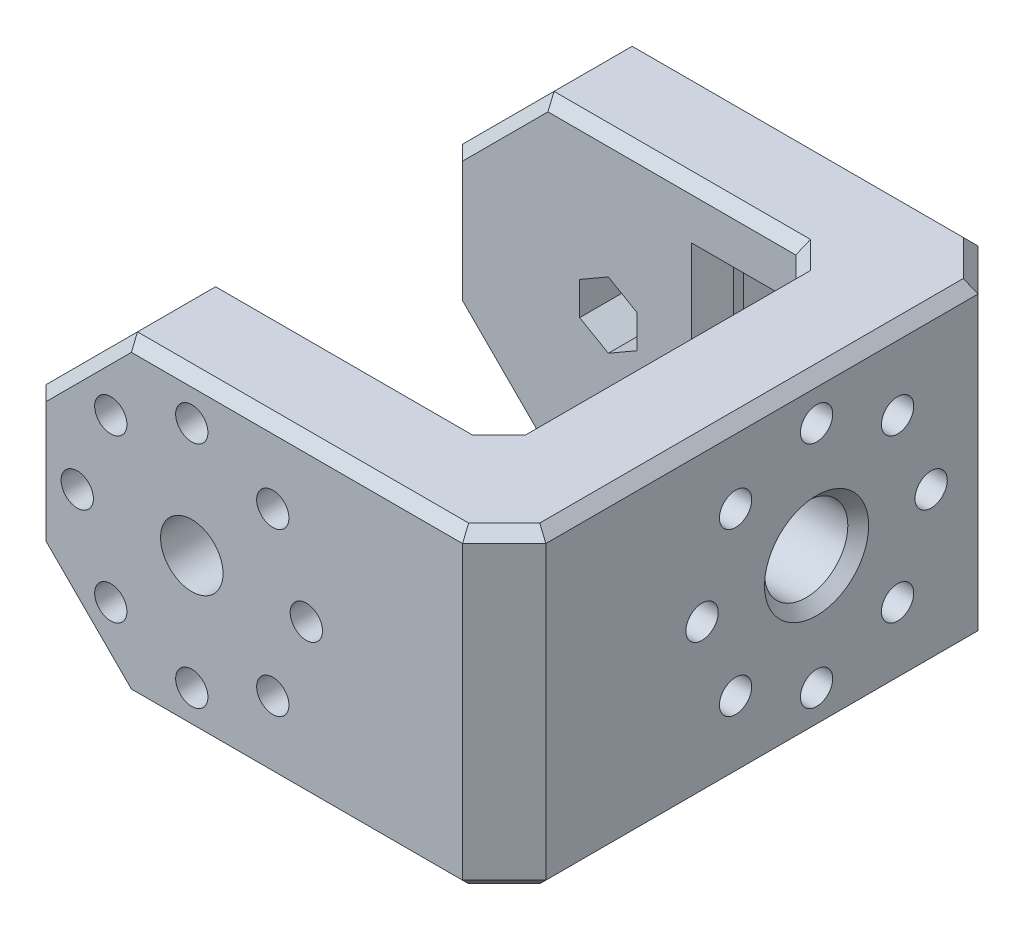
from build123d import *

# Parameters (mm, degrees)
SALIENTE_EXTRUIR1_DEPTH = 60
CROQUIS2_W              = 35
CROQUIS2_H              = 30.5
CROQUIS2_H_2            = 10.5
CORTAR_EXTRUIR1_DEPTH   = 74.484692283
CORTAR_EXTRUIR2_REACH   = 70.739
CROQUIS3_R              = 3
CROQUIS12_R             = 6
SALIENTE_EXTRUIR2_DEPTH = 1
CORTAR_EXTRUIR3_REACH   = 62.624
CROQUIS4_R              = 1.5
CORTAR_EXTRUIR4_DEPTH   = 5
CROQUIS9_W              = 10
CROQUIS9_H              = 20
CORTAR_EXTRUIR7_DEPTH   = 5
CORTAR_EXTRUIR5_REACH   = 78.485
CROQUIS7_R              = 4
CROQUIS7_R_2            = 1.55
CORTAR_EXTRUIR6_REACH   = 83.485
CORTAR_EXTRUIR6_START   = -5
CORTAR_EXTRUIR8_REACH   = 70.739
CROQUIS10_R             = 1.55
CORTAR_EXTRUIR9_REACH   = 75.739
CORTAR_EXTRUIR9_START   = -5
CROQUIS13_W             = 10
CROQUIS13_H             = 10.5
CORTAR_EXTRUIR10_DEPTH  = 74.484692283
CHAFL_N7_SIZE           = 4
CHAFL_N5_SIZE           = 0.5
CHAFL_N6_SIZE           = 1
CHAFL_N4_SIZE           = 1
CHAFL_N3_SIZE           = 1
CHAFL_N1_SIZE           = 2
CHAFL_N2_SIZE           = 1


# Some blends are built 0.0001 mm under size
with BuildPart() as part:
    # Croquis1 → Saliente-Extruir1 (new body)
    with BuildSketch(Plane.XY):
        Polygon((6.213203436, 15), (30, 15), (30, -15), (6.213203436, -15), (-6.213203436, -15), (-15, -6.213203436), (-15, 6.213203436), (-6.213203436, 15), align=None)
    extrude(amount=SALIENTE_EXTRUIR1_DEPTH)

    # Croquis2 → Cortar-Extruir1 (cut, through all)
    with BuildSketch(Plane(origin=(0, 15, 0), x_dir=(1, 0, 0), z_dir=(0, 1, 0))):
        with Locations((2.5, -35.25)):
            Rectangle(CROQUIS2_W, CROQUIS2_H)
        with Locations((2.5, -5.25)):
            Rectangle(CROQUIS2_W, CROQUIS2_H_2)
    extrude(amount=-CORTAR_EXTRUIR1_DEPTH, mode=Mode.SUBTRACT)

    # Croquis3 → Cortar-Extruir2 (cut, up to next)
    with BuildSketch(Plane.XY.offset(60), mode=Mode.PRIVATE) as cortar_extruir2_sk1:
        Circle(CROQUIS3_R)
    cortar_extruir2_tool1 = extrude(cortar_extruir2_sk1.sketch, amount=-CORTAR_EXTRUIR2_REACH, mode=Mode.PRIVATE) & part.part
    add(cortar_extruir2_tool1.solids().sort_by_distance((0, 0, 60))[0], mode=Mode.SUBTRACT)

    # Croquis12 → Saliente-Extruir2 (add)
    with BuildSketch(Plane(origin=(0, 0, 10.5), x_dir=(-1, 0, 0), z_dir=(0, 0, -1))):
        with Locations(Location((0, 0, 0), (0, 0, 180))):
            Circle(CROQUIS12_R)
    extrude(amount=SALIENTE_EXTRUIR2_DEPTH)

    # Croquis4 → Cortar-Extruir3 (cut, up to next)
    with BuildSketch(Plane(origin=(0, 0, 9.5), x_dir=(-1, 0, 0), z_dir=(0, 0, -1)), mode=Mode.PRIVATE) as cortar_extruir3_sk1:
        Circle(CROQUIS4_R)
    cortar_extruir3_tool1 = extrude(cortar_extruir3_sk1.sketch, amount=-CORTAR_EXTRUIR3_REACH, mode=Mode.PRIVATE) & part.part
    add(cortar_extruir3_tool1.solids().sort_by_distance((0, 0, 9.5))[0], mode=Mode.SUBTRACT)

    # Croquis5 → Cortar-Extruir4 (cut)
    with BuildSketch(Plane.XY.offset(20)):
        Polygon((0, 3.175426481), (-2.75, 1.58771324), (-2.75, -1.58771324), (0, -3.175426481), (2.75, -1.58771324), (2.75, 1.58771324), align=None)
    extrude(amount=-CORTAR_EXTRUIR4_DEPTH, mode=Mode.SUBTRACT)

    # Croquis9 → Cortar-Extruir7 (cut)
    with BuildSketch(Plane.XY.offset(20)):
        with Locations((15, 0)):
            Rectangle(CROQUIS9_W, CROQUIS9_H)
    extrude(amount=-CORTAR_EXTRUIR7_DEPTH, mode=Mode.SUBTRACT)

    # Croquis7 → Cortar-Extruir5 (cut, up to next)
    with BuildSketch(Plane(origin=(30, 0, 0), x_dir=(0, 0, -1), z_dir=(1, 0, 0)), mode=Mode.PRIVATE) as cortar_extruir5_sk1:
        with Locations(Location((-30, 0, 0), (0, 0, 90))):
            Circle(CROQUIS7_R)
    cortar_extruir5_tool1 = extrude(cortar_extruir5_sk1.sketch, amount=-CORTAR_EXTRUIR5_REACH, mode=Mode.PRIVATE) & part.part
    # Croquis7 → Cortar-Extruir5 (cut, up to next)
    with BuildSketch(Plane(origin=(30, 0, 0), x_dir=(0, 0, -1), z_dir=(1, 0, 0)), mode=Mode.PRIVATE) as cortar_extruir5_sk2:
        with Locations(Location((-30, 11, 0), (0, 0, 90))):
            Circle(CROQUIS7_R_2)
    cortar_extruir5_tool2 = extrude(cortar_extruir5_sk2.sketch, amount=-CORTAR_EXTRUIR5_REACH, mode=Mode.PRIVATE) & part.part
    # Croquis7 → Cortar-Extruir5 (cut, up to next)
    with BuildSketch(Plane(origin=(30, 0, 0), x_dir=(0, 0, -1), z_dir=(1, 0, 0)), mode=Mode.PRIVATE) as cortar_extruir5_sk3:
        with Locations(Location((-22.221825407, 7.778174593, 0), (0, 0, 90))):
            Circle(CROQUIS7_R_2)
    cortar_extruir5_tool3 = extrude(cortar_extruir5_sk3.sketch, amount=-CORTAR_EXTRUIR5_REACH, mode=Mode.PRIVATE) & part.part
    # Croquis7 → Cortar-Extruir5 (cut, up to next)
    with BuildSketch(Plane(origin=(30, 0, 0), x_dir=(0, 0, -1), z_dir=(1, 0, 0)), mode=Mode.PRIVATE) as cortar_extruir5_sk4:
        with Locations(Location((-19, 0, 0), (0, 0, 90))):
            Circle(CROQUIS7_R_2)
    cortar_extruir5_tool4 = extrude(cortar_extruir5_sk4.sketch, amount=-CORTAR_EXTRUIR5_REACH, mode=Mode.PRIVATE) & part.part
    # Croquis7 → Cortar-Extruir5 (cut, up to next)
    with BuildSketch(Plane(origin=(30, 0, 0), x_dir=(0, 0, -1), z_dir=(1, 0, 0)), mode=Mode.PRIVATE) as cortar_extruir5_sk5:
        with Locations(Location((-22.221825407, -7.778174593, 0), (0, 0, 90))):
            Circle(CROQUIS7_R_2)
    cortar_extruir5_tool5 = extrude(cortar_extruir5_sk5.sketch, amount=-CORTAR_EXTRUIR5_REACH, mode=Mode.PRIVATE) & part.part
    # Croquis7 → Cortar-Extruir5 (cut, up to next)
    with BuildSketch(Plane(origin=(30, 0, 0), x_dir=(0, 0, -1), z_dir=(1, 0, 0)), mode=Mode.PRIVATE) as cortar_extruir5_sk6:
        with Locations(Location((-30, -11, 0), (0, 0, 90))):
            Circle(CROQUIS7_R_2)
    cortar_extruir5_tool6 = extrude(cortar_extruir5_sk6.sketch, amount=-CORTAR_EXTRUIR5_REACH, mode=Mode.PRIVATE) & part.part
    # Croquis7 → Cortar-Extruir5 (cut, up to next)
    with BuildSketch(Plane(origin=(30, 0, 0), x_dir=(0, 0, -1), z_dir=(1, 0, 0)), mode=Mode.PRIVATE) as cortar_extruir5_sk7:
        with Locations(Location((-37.778174593, -7.778174593, 0), (0, 0, 90))):
            Circle(CROQUIS7_R_2)
    cortar_extruir5_tool7 = extrude(cortar_extruir5_sk7.sketch, amount=-CORTAR_EXTRUIR5_REACH, mode=Mode.PRIVATE) & part.part
    # Croquis7 → Cortar-Extruir5 (cut, up to next)
    with BuildSketch(Plane(origin=(30, 0, 0), x_dir=(0, 0, -1), z_dir=(1, 0, 0)), mode=Mode.PRIVATE) as cortar_extruir5_sk8:
        with Locations(Location((-41, 0, 0), (0, 0, 90))):
            Circle(CROQUIS7_R_2)
    cortar_extruir5_tool8 = extrude(cortar_extruir5_sk8.sketch, amount=-CORTAR_EXTRUIR5_REACH, mode=Mode.PRIVATE) & part.part
    # Croquis7 → Cortar-Extruir5 (cut, up to next)
    with BuildSketch(Plane(origin=(30, 0, 0), x_dir=(0, 0, -1), z_dir=(1, 0, 0)), mode=Mode.PRIVATE) as cortar_extruir5_sk9:
        with Locations(Location((-37.778174593, 7.778174593, 0), (0, 0, 90))):
            Circle(CROQUIS7_R_2)
    cortar_extruir5_tool9 = extrude(cortar_extruir5_sk9.sketch, amount=-CORTAR_EXTRUIR5_REACH, mode=Mode.PRIVATE) & part.part
    add(cortar_extruir5_tool1.solids().sort_by_distance((30, 0, 30))[0], mode=Mode.SUBTRACT)
    add(cortar_extruir5_tool2.solids().sort_by_distance((30, 11, 30))[0], mode=Mode.SUBTRACT)
    add(cortar_extruir5_tool3.solids().sort_by_distance((30, 7.778175, 22.221825))[0], mode=Mode.SUBTRACT)
    add(cortar_extruir5_tool4.solids().sort_by_distance((30, 0, 19))[0], mode=Mode.SUBTRACT)
    add(cortar_extruir5_tool5.solids().sort_by_distance((30, -7.778175, 22.221825))[0], mode=Mode.SUBTRACT)
    add(cortar_extruir5_tool6.solids().sort_by_distance((30, -11, 30))[0], mode=Mode.SUBTRACT)
    add(cortar_extruir5_tool7.solids().sort_by_distance((30, -7.778175, 37.778175))[0], mode=Mode.SUBTRACT)
    add(cortar_extruir5_tool8.solids().sort_by_distance((30, 0, 41))[0], mode=Mode.SUBTRACT)
    add(cortar_extruir5_tool9.solids().sort_by_distance((30, 7.778175, 37.778175))[0], mode=Mode.SUBTRACT)

    # Croquis8 → Cortar-Extruir6 (cut, up to next)
    with BuildSketch(Plane(origin=(30, 0, 0), x_dir=(0, 0, -1), z_dir=(1, 0, 0)).offset(CORTAR_EXTRUIR6_START), mode=Mode.PRIVATE) as cortar_extruir6_sk1:
        Polygon((-19.976459809, 5.532808996), (-19.15459896, 8.600035443), (-21.399964557, 10.84540104), (-24.467191004, 10.023540191), (-25.289051854, 6.956313744), (-23.043686256, 4.710948146), align=None)
    cortar_extruir6_tool1 = extrude(cortar_extruir6_sk1.sketch, amount=-CORTAR_EXTRUIR6_REACH, mode=Mode.PRIVATE) & part.part
    # Croquis8 → Cortar-Extruir6 (cut, up to next)
    with BuildSketch(Plane(origin=(30, 0, 0), x_dir=(0, 0, -1), z_dir=(1, 0, 0)).offset(CORTAR_EXTRUIR6_START), mode=Mode.PRIVATE) as cortar_extruir6_sk2:
        Polygon((-26.824573519, 11), (-28.41228676, 13.75), (-31.58771324, 13.75), (-33.175426481, 11), (-31.58771324, 8.25), (-28.41228676, 8.25), align=None)
    cortar_extruir6_tool2 = extrude(cortar_extruir6_sk2.sketch, amount=-CORTAR_EXTRUIR6_REACH, mode=Mode.PRIVATE) & part.part
    # Croquis8 → Cortar-Extruir6 (cut, up to next)
    with BuildSketch(Plane(origin=(30, 0, 0), x_dir=(0, 0, -1), z_dir=(1, 0, 0)).offset(CORTAR_EXTRUIR6_START), mode=Mode.PRIVATE) as cortar_extruir6_sk3:
        Polygon((-19, -3.175426481), (-16.25, -1.58771324), (-16.25, 1.58771324), (-19, 3.175426481), (-21.75, 1.58771324), (-21.75, -1.58771324), align=None)
    cortar_extruir6_tool3 = extrude(cortar_extruir6_sk3.sketch, amount=-CORTAR_EXTRUIR6_REACH, mode=Mode.PRIVATE) & part.part
    # Croquis8 → Cortar-Extruir6 (cut, up to next)
    with BuildSketch(Plane(origin=(30, 0, 0), x_dir=(0, 0, -1), z_dir=(1, 0, 0)).offset(CORTAR_EXTRUIR6_START), mode=Mode.PRIVATE) as cortar_extruir6_sk4:
        Polygon((-24.467191004, -10.023540191), (-21.399964557, -10.84540104), (-19.15459896, -8.600035443), (-19.976459809, -5.532808996), (-23.043686256, -4.710948146), (-25.289051854, -6.956313744), align=None)
    cortar_extruir6_tool4 = extrude(cortar_extruir6_sk4.sketch, amount=-CORTAR_EXTRUIR6_REACH, mode=Mode.PRIVATE) & part.part
    # Croquis8 → Cortar-Extruir6 (cut, up to next)
    with BuildSketch(Plane(origin=(30, 0, 0), x_dir=(0, 0, -1), z_dir=(1, 0, 0)).offset(CORTAR_EXTRUIR6_START), mode=Mode.PRIVATE) as cortar_extruir6_sk5:
        Polygon((-33.175426481, -11), (-31.58771324, -13.75), (-28.41228676, -13.75), (-26.824573519, -11), (-28.41228676, -8.25), (-31.58771324, -8.25), align=None)
    cortar_extruir6_tool5 = extrude(cortar_extruir6_sk5.sketch, amount=-CORTAR_EXTRUIR6_REACH, mode=Mode.PRIVATE) & part.part
    # Croquis8 → Cortar-Extruir6 (cut, up to next)
    with BuildSketch(Plane(origin=(30, 0, 0), x_dir=(0, 0, -1), z_dir=(1, 0, 0)).offset(CORTAR_EXTRUIR6_START), mode=Mode.PRIVATE) as cortar_extruir6_sk6:
        Polygon((-40.023540191, -5.532808996), (-40.84540104, -8.600035443), (-38.600035443, -10.84540104), (-35.532808996, -10.023540191), (-34.710948146, -6.956313744), (-36.956313744, -4.710948146), align=None)
    cortar_extruir6_tool6 = extrude(cortar_extruir6_sk6.sketch, amount=-CORTAR_EXTRUIR6_REACH, mode=Mode.PRIVATE) & part.part
    # Croquis8 → Cortar-Extruir6 (cut, up to next)
    with BuildSketch(Plane(origin=(30, 0, 0), x_dir=(0, 0, -1), z_dir=(1, 0, 0)).offset(CORTAR_EXTRUIR6_START), mode=Mode.PRIVATE) as cortar_extruir6_sk7:
        Polygon((-41, 3.175426481), (-43.75, 1.58771324), (-43.75, -1.58771324), (-41, -3.175426481), (-38.25, -1.58771324), (-38.25, 1.58771324), align=None)
    cortar_extruir6_tool7 = extrude(cortar_extruir6_sk7.sketch, amount=-CORTAR_EXTRUIR6_REACH, mode=Mode.PRIVATE) & part.part
    # Croquis8 → Cortar-Extruir6 (cut, up to next)
    with BuildSketch(Plane(origin=(30, 0, 0), x_dir=(0, 0, -1), z_dir=(1, 0, 0)).offset(CORTAR_EXTRUIR6_START), mode=Mode.PRIVATE) as cortar_extruir6_sk8:
        Polygon((-35.532808996, 10.023540191), (-38.600035443, 10.84540104), (-40.84540104, 8.600035443), (-40.023540191, 5.532808996), (-36.956313744, 4.710948146), (-34.710948146, 6.956313744), align=None)
    cortar_extruir6_tool8 = extrude(cortar_extruir6_sk8.sketch, amount=-CORTAR_EXTRUIR6_REACH, mode=Mode.PRIVATE) & part.part
    add(cortar_extruir6_tool1.solids().sort_by_distance((25, 7.778175, 22.221825))[0], mode=Mode.SUBTRACT)
    add(cortar_extruir6_tool2.solids().sort_by_distance((25, 11, 30))[0], mode=Mode.SUBTRACT)
    add(cortar_extruir6_tool3.solids().sort_by_distance((25, 0, 19))[0], mode=Mode.SUBTRACT)
    add(cortar_extruir6_tool4.solids().sort_by_distance((25, -7.778175, 22.221825))[0], mode=Mode.SUBTRACT)
    add(cortar_extruir6_tool5.solids().sort_by_distance((25, -11, 30))[0], mode=Mode.SUBTRACT)
    add(cortar_extruir6_tool6.solids().sort_by_distance((25, -7.778175, 37.778175))[0], mode=Mode.SUBTRACT)
    add(cortar_extruir6_tool7.solids().sort_by_distance((25, 0, 41))[0], mode=Mode.SUBTRACT)
    add(cortar_extruir6_tool8.solids().sort_by_distance((25, 7.778175, 37.778175))[0], mode=Mode.SUBTRACT)

    # Croquis10 → Cortar-Extruir8 (cut, up to next)
    with BuildSketch(Plane.XY.offset(60), mode=Mode.PRIVATE) as cortar_extruir8_sk1:
        with Locations((0, 11)):
            Circle(CROQUIS10_R)
    cortar_extruir8_tool1 = extrude(cortar_extruir8_sk1.sketch, amount=-CORTAR_EXTRUIR8_REACH, mode=Mode.PRIVATE) & part.part
    # Croquis10 → Cortar-Extruir8 (cut, up to next)
    with BuildSketch(Plane.XY.offset(60), mode=Mode.PRIVATE) as cortar_extruir8_sk2:
        with Locations((7.778174593, 7.778174593)):
            Circle(CROQUIS10_R)
    cortar_extruir8_tool2 = extrude(cortar_extruir8_sk2.sketch, amount=-CORTAR_EXTRUIR8_REACH, mode=Mode.PRIVATE) & part.part
    # Croquis10 → Cortar-Extruir8 (cut, up to next)
    with BuildSketch(Plane.XY.offset(60), mode=Mode.PRIVATE) as cortar_extruir8_sk3:
        with Locations((11, 0)):
            Circle(CROQUIS10_R)
    cortar_extruir8_tool3 = extrude(cortar_extruir8_sk3.sketch, amount=-CORTAR_EXTRUIR8_REACH, mode=Mode.PRIVATE) & part.part
    # Croquis10 → Cortar-Extruir8 (cut, up to next)
    with BuildSketch(Plane.XY.offset(60), mode=Mode.PRIVATE) as cortar_extruir8_sk4:
        with Locations((7.778174593, -7.778174593)):
            Circle(CROQUIS10_R)
    cortar_extruir8_tool4 = extrude(cortar_extruir8_sk4.sketch, amount=-CORTAR_EXTRUIR8_REACH, mode=Mode.PRIVATE) & part.part
    # Croquis10 → Cortar-Extruir8 (cut, up to next)
    with BuildSketch(Plane.XY.offset(60), mode=Mode.PRIVATE) as cortar_extruir8_sk5:
        with Locations((0, -11)):
            Circle(CROQUIS10_R)
    cortar_extruir8_tool5 = extrude(cortar_extruir8_sk5.sketch, amount=-CORTAR_EXTRUIR8_REACH, mode=Mode.PRIVATE) & part.part
    # Croquis10 → Cortar-Extruir8 (cut, up to next)
    with BuildSketch(Plane.XY.offset(60), mode=Mode.PRIVATE) as cortar_extruir8_sk6:
        with Locations((-7.778174593, -7.778174593)):
            Circle(CROQUIS10_R)
    cortar_extruir8_tool6 = extrude(cortar_extruir8_sk6.sketch, amount=-CORTAR_EXTRUIR8_REACH, mode=Mode.PRIVATE) & part.part
    # Croquis10 → Cortar-Extruir8 (cut, up to next)
    with BuildSketch(Plane.XY.offset(60), mode=Mode.PRIVATE) as cortar_extruir8_sk7:
        with Locations((-11, 0)):
            Circle(CROQUIS10_R)
    cortar_extruir8_tool7 = extrude(cortar_extruir8_sk7.sketch, amount=-CORTAR_EXTRUIR8_REACH, mode=Mode.PRIVATE) & part.part
    # Croquis10 → Cortar-Extruir8 (cut, up to next)
    with BuildSketch(Plane.XY.offset(60), mode=Mode.PRIVATE) as cortar_extruir8_sk8:
        with Locations((-7.778174593, 7.778174593)):
            Circle(CROQUIS10_R)
    cortar_extruir8_tool8 = extrude(cortar_extruir8_sk8.sketch, amount=-CORTAR_EXTRUIR8_REACH, mode=Mode.PRIVATE) & part.part
    add(cortar_extruir8_tool1.solids().sort_by_distance((0, 11, 60))[0], mode=Mode.SUBTRACT)
    add(cortar_extruir8_tool2.solids().sort_by_distance((7.778175, 7.778175, 60))[0], mode=Mode.SUBTRACT)
    add(cortar_extruir8_tool3.solids().sort_by_distance((11, 0, 60))[0], mode=Mode.SUBTRACT)
    add(cortar_extruir8_tool4.solids().sort_by_distance((7.778175, -7.778175, 60))[0], mode=Mode.SUBTRACT)
    add(cortar_extruir8_tool5.solids().sort_by_distance((0, -11, 60))[0], mode=Mode.SUBTRACT)
    add(cortar_extruir8_tool6.solids().sort_by_distance((-7.778175, -7.778175, 60))[0], mode=Mode.SUBTRACT)
    add(cortar_extruir8_tool7.solids().sort_by_distance((-11, 0, 60))[0], mode=Mode.SUBTRACT)
    add(cortar_extruir8_tool8.solids().sort_by_distance((-7.778175, 7.778175, 60))[0], mode=Mode.SUBTRACT)

    # Croquis11 → Cortar-Extruir9 (cut, up to next)
    with BuildSketch(Plane.XY.offset(60).offset(CORTAR_EXTRUIR9_START), mode=Mode.PRIVATE) as cortar_extruir9_sk1:
        Polygon((10.023540191, 5.532808996), (10.84540104, 8.600035443), (8.600035443, 10.84540104), (5.532808996, 10.023540191), (4.710948146, 6.956313744), (6.956313744, 4.710948146), align=None)
    cortar_extruir9_tool1 = extrude(cortar_extruir9_sk1.sketch, amount=-CORTAR_EXTRUIR9_REACH, mode=Mode.PRIVATE) & part.part
    # Croquis11 → Cortar-Extruir9 (cut, up to next)
    with BuildSketch(Plane.XY.offset(60).offset(CORTAR_EXTRUIR9_START), mode=Mode.PRIVATE) as cortar_extruir9_sk2:
        Polygon((3.175426481, 11), (1.58771324, 13.75), (-1.58771324, 13.75), (-3.175426481, 11), (-1.58771324, 8.25), (1.58771324, 8.25), align=None)
    cortar_extruir9_tool2 = extrude(cortar_extruir9_sk2.sketch, amount=-CORTAR_EXTRUIR9_REACH, mode=Mode.PRIVATE) & part.part
    # Croquis11 → Cortar-Extruir9 (cut, up to next)
    with BuildSketch(Plane.XY.offset(60).offset(CORTAR_EXTRUIR9_START), mode=Mode.PRIVATE) as cortar_extruir9_sk3:
        Polygon((11, -3.175426481), (13.75, -1.58771324), (13.75, 1.58771324), (11, 3.175426481), (8.25, 1.58771324), (8.25, -1.58771324), align=None)
    cortar_extruir9_tool3 = extrude(cortar_extruir9_sk3.sketch, amount=-CORTAR_EXTRUIR9_REACH, mode=Mode.PRIVATE) & part.part
    # Croquis11 → Cortar-Extruir9 (cut, up to next)
    with BuildSketch(Plane.XY.offset(60).offset(CORTAR_EXTRUIR9_START), mode=Mode.PRIVATE) as cortar_extruir9_sk4:
        Polygon((5.532808996, -10.023540191), (8.600035443, -10.84540104), (10.84540104, -8.600035443), (10.023540191, -5.532808996), (6.956313744, -4.710948146), (4.710948146, -6.956313744), align=None)
    cortar_extruir9_tool4 = extrude(cortar_extruir9_sk4.sketch, amount=-CORTAR_EXTRUIR9_REACH, mode=Mode.PRIVATE) & part.part
    # Croquis11 → Cortar-Extruir9 (cut, up to next)
    with BuildSketch(Plane.XY.offset(60).offset(CORTAR_EXTRUIR9_START), mode=Mode.PRIVATE) as cortar_extruir9_sk5:
        Polygon((-3.175426481, -11), (-1.58771324, -13.75), (1.58771324, -13.75), (3.175426481, -11), (1.58771324, -8.25), (-1.58771324, -8.25), align=None)
    cortar_extruir9_tool5 = extrude(cortar_extruir9_sk5.sketch, amount=-CORTAR_EXTRUIR9_REACH, mode=Mode.PRIVATE) & part.part
    # Croquis11 → Cortar-Extruir9 (cut, up to next)
    with BuildSketch(Plane.XY.offset(60).offset(CORTAR_EXTRUIR9_START), mode=Mode.PRIVATE) as cortar_extruir9_sk6:
        Polygon((-10.023540191, -5.532808996), (-10.84540104, -8.600035443), (-8.600035443, -10.84540104), (-5.532808995, -10.023540191), (-4.710948146, -6.956313744), (-6.956313744, -4.710948146), align=None)
    cortar_extruir9_tool6 = extrude(cortar_extruir9_sk6.sketch, amount=-CORTAR_EXTRUIR9_REACH, mode=Mode.PRIVATE) & part.part
    # Croquis11 → Cortar-Extruir9 (cut, up to next)
    with BuildSketch(Plane.XY.offset(60).offset(CORTAR_EXTRUIR9_START), mode=Mode.PRIVATE) as cortar_extruir9_sk7:
        Polygon((-11, 3.175426481), (-13.75, 1.58771324), (-13.75, -1.58771324), (-11, -3.175426481), (-8.25, -1.58771324), (-8.25, 1.58771324), align=None)
    cortar_extruir9_tool7 = extrude(cortar_extruir9_sk7.sketch, amount=-CORTAR_EXTRUIR9_REACH, mode=Mode.PRIVATE) & part.part
    # Croquis11 → Cortar-Extruir9 (cut, up to next)
    with BuildSketch(Plane.XY.offset(60).offset(CORTAR_EXTRUIR9_START), mode=Mode.PRIVATE) as cortar_extruir9_sk8:
        Polygon((-5.532808996, 10.023540191), (-8.600035443, 10.84540104), (-10.84540104, 8.600035443), (-10.023540191, 5.532808996), (-6.956313744, 4.710948146), (-4.710948146, 6.956313744), align=None)
    cortar_extruir9_tool8 = extrude(cortar_extruir9_sk8.sketch, amount=-CORTAR_EXTRUIR9_REACH, mode=Mode.PRIVATE) & part.part
    add(cortar_extruir9_tool1.solids().sort_by_distance((7.778175, 7.778175, 55))[0], mode=Mode.SUBTRACT)
    add(cortar_extruir9_tool2.solids().sort_by_distance((0, 11, 55))[0], mode=Mode.SUBTRACT)
    add(cortar_extruir9_tool3.solids().sort_by_distance((11, 0, 55))[0], mode=Mode.SUBTRACT)
    add(cortar_extruir9_tool4.solids().sort_by_distance((7.778175, -7.778175, 55))[0], mode=Mode.SUBTRACT)
    add(cortar_extruir9_tool5.solids().sort_by_distance((0, -11, 55))[0], mode=Mode.SUBTRACT)
    add(cortar_extruir9_tool6.solids().sort_by_distance((-7.778175, -7.778175, 55))[0], mode=Mode.SUBTRACT)
    add(cortar_extruir9_tool7.solids().sort_by_distance((-11, 0, 55))[0], mode=Mode.SUBTRACT)
    add(cortar_extruir9_tool8.solids().sort_by_distance((-7.778175, 7.778175, 55))[0], mode=Mode.SUBTRACT)

    # Croquis13 → Cortar-Extruir10 (cut, through all)
    with BuildSketch(Plane(origin=(0, 15, 0), x_dir=(1, 0, 0), z_dir=(0, 1, 0))):
        with Locations((25, -5.25)):
            Rectangle(CROQUIS13_W, CROQUIS13_H)
    extrude(amount=-CORTAR_EXTRUIR10_DEPTH, mode=Mode.SUBTRACT)

    # Chaflán7
    chafl_n7_edges = [part.edges().sort_by_distance(p)[0] for p in [
        (30, 0, 10.5),
        (30, 0, 60),
    ]]
    chamfer(chafl_n7_edges, length=CHAFL_N7_SIZE)

    # Chaflán5
    chafl_n5_edges = [part.edges().sort_by_distance(p)[0] for p in [
        (1.5, 0, 9.5),
    ]]
    chamfer(chafl_n5_edges, length=CHAFL_N5_SIZE)

    # Chaflán6
    chafl_n6_edges = [part.edges().sort_by_distance(p)[0] for p in [
        (-6, 0, 10.5),
    ]]
    chamfer(chafl_n6_edges, length=CHAFL_N6_SIZE - 0.0001)  # a hair under: the kernel refuses the full size

    # Chaflán4
    chafl_n4_edges = [part.edges().sort_by_distance(p)[0] for p in [
        (30, -4, 30),
        (20, -4, 30),
    ]]
    chamfer(chafl_n4_edges, length=CHAFL_N4_SIZE)

    # Chaflán3
    chafl_n3_edges = [part.edges().sort_by_distance(p)[0] for p in [
        (-3, 0, 50.5),
    ]]
    chamfer(chafl_n3_edges, length=CHAFL_N3_SIZE)

    # Chaflán1
    # the kernel refuses this chamfer: 2 mm, written as the material it adds along each edge
    with BuildSketch(Plane(origin=(20, 15, 50.5), x_dir=(-0.9996219169112968, 0, 0.027495876610585647), z_dir=(0, -1, 0))) as chafl_n1_piece_1:
        Polygon((CHAFL_N1_SIZE * 0.999621916911, CHAFL_N1_SIZE * 0.0274958766106), (-CHAFL_N1_SIZE * 0.0274958766106, CHAFL_N1_SIZE * 0.999621916911), (0, 0), align=None)
    extrude(amount=30)
    with BuildSketch(Plane(origin=(20, -10, 20), x_dir=(0.027495876610585647, 0, 0.9996219169112968), z_dir=(0, -1, 0))) as chafl_n1_piece_2_section:
        Polygon((CHAFL_N1_SIZE * 0.999621916911, CHAFL_N1_SIZE * 0.0274958766106), (-CHAFL_N1_SIZE * 0.0274958766106, CHAFL_N1_SIZE * 0.999621916911), (0, 0), align=None)
    chafl_n1_piece_2 = extrude(amount=5, mode=Mode.PRIVATE)
    chafl_n1_piece_2 = split(chafl_n1_piece_2, bisect_by=Plane(origin=(19.216720762, -10.235610769, 20.790174286), z_dir=(0, -0.7071067811865523, -0.7071067811865428)), keep=Keep.TOP, mode=Mode.PRIVATE)
    add(chafl_n1_piece_2)
    with BuildSketch(Plane(origin=(20, -4.856634024, 20), x_dir=(0.027495876610585647, 0, 0.9996219169112968), z_dir=(0, -1, 0))) as chafl_n1_piece_3_section:
        Polygon((CHAFL_N1_SIZE * 0.999621916911, CHAFL_N1_SIZE * 0.0274958766106), (-CHAFL_N1_SIZE * 0.0274958766106, CHAFL_N1_SIZE * 0.999621916911), (0, 0), align=None)
    chafl_n1_piece_3 = extrude(amount=15.286731952, mode=Mode.PRIVATE)
    chafl_n1_piece_3 = split(chafl_n1_piece_3, bisect_by=Plane(origin=(19.849991139, -11.050316955, 21.604880472), z_dir=(0, 0.7071067811865523, 0.7071067811865428)), keep=Keep.TOP, mode=Mode.PRIVATE)
    chafl_n1_piece_3 = split(chafl_n1_piece_3, bisect_by=Plane(origin=(19.849991139, -10.77775276, 21.652431375), z_dir=(0, -0.9659258262890669, 0.2588190451025261)), keep=Keep.TOP, mode=Mode.PRIVATE)
    add(chafl_n1_piece_3)
    with BuildSketch(Plane(origin=(20, 15, 20), x_dir=(0.027495876610585647, 0, 0.9996219169112968), z_dir=(0, -1, 0))) as chafl_n1_piece_4_section:
        Polygon((CHAFL_N1_SIZE * 0.999621916911, CHAFL_N1_SIZE * 0.0274958766106), (-CHAFL_N1_SIZE * 0.0274958766106, CHAFL_N1_SIZE * 0.999621916911), (0, 0), align=None)
    chafl_n1_piece_4 = extrude(amount=10.143365976, mode=Mode.PRIVATE)
    chafl_n1_piece_4 = split(chafl_n1_piece_4, bisect_by=Plane(origin=(19.337901825, 11.172841883, 20.177938697), z_dir=(0, 0.965925826289068, 0.2588190451025222)), keep=Keep.TOP, mode=Mode.PRIVATE)
    add(chafl_n1_piece_4)
    with BuildSketch(Plane(origin=(20, 20.143365976, 20), x_dir=(0.027495876610585647, 0, 0.9996219169112968), z_dir=(0, -1, 0))) as chafl_n1_piece_5_section:
        Polygon((CHAFL_N1_SIZE * 0.999621916911, CHAFL_N1_SIZE * 0.0274958766106), (-CHAFL_N1_SIZE * 0.0274958766106, CHAFL_N1_SIZE * 0.999621916911), (0, 0), align=None)
    chafl_n1_piece_5 = extrude(amount=10.143365976, mode=Mode.PRIVATE)
    chafl_n1_piece_5 = split(chafl_n1_piece_5, bisect_by=Plane(origin=(19.216720762, 10.235610769, 20.790174286), z_dir=(0, 0.7071067811865456, -0.7071067811865496)), keep=Keep.TOP, mode=Mode.PRIVATE)
    chafl_n1_piece_5 = split(chafl_n1_piece_5, bisect_by=Plane(origin=(19.216720762, 11.07008016, 20.561450667), z_dir=(0, -0.965925826289068, -0.2588190451025222)), keep=Keep.TOP, mode=Mode.PRIVATE)
    add(chafl_n1_piece_5)
    with BuildSketch(Plane(origin=(20, 10, 15), x_dir=(0.027495876610582247, 0, 0.999621916911297), z_dir=(0, -1, 0))) as chafl_n1_piece_6_section:
        Polygon((CHAFL_N1_SIZE * 0.999621916911, CHAFL_N1_SIZE * 0.0274958766106), (-CHAFL_N1_SIZE * 0.0274958766106, CHAFL_N1_SIZE * 0.999621916911), (0, 0), align=None)
    chafl_n1_piece_6 = extrude(amount=25.143365976, mode=Mode.PRIVATE)
    chafl_n1_piece_6 = split(chafl_n1_piece_6, bisect_by=Plane(origin=(19.748908907, 2.764442057, 18.288154097), z_dir=(0, 0.8660254037844382, -0.5000000000000009)), keep=Keep.TOP, mode=Mode.PRIVATE)
    add(chafl_n1_piece_6)
    with BuildSketch(Plane(origin=(20, 15.143365976, 15), x_dir=(0.027495876610585647, 0, 0.9996219169112968), z_dir=(0, -1, 0))) as chafl_n1_piece_7_section:
        Polygon((CHAFL_N1_SIZE * 0.999621916911, CHAFL_N1_SIZE * 0.0274958766106), (-CHAFL_N1_SIZE * 0.0274958766106, CHAFL_N1_SIZE * 0.999621916911), (0, 0), align=None)
    chafl_n1_piece_7 = extrude(amount=25.143365976, mode=Mode.PRIVATE)
    chafl_n1_piece_7 = split(chafl_n1_piece_7, bisect_by=Plane(origin=(19.295009328, 0, 16.25), z_dir=(0, 0, -1)), keep=Keep.TOP, mode=Mode.PRIVATE)
    chafl_n1_piece_7 = split(chafl_n1_piece_7, bisect_by=Plane(origin=(19.295009328, 0.905004626, 15.067513993), z_dir=(0, -0.8660254037844382, 0.5000000000000009)), keep=Keep.TOP, mode=Mode.PRIVATE)
    add(chafl_n1_piece_7)
    with BuildSketch(Plane(origin=(20, 15.143365976, 15), x_dir=(0.027495876610585647, 0, 0.9996219169112968), z_dir=(0, -1, 0))) as chafl_n1_piece_8_section:
        Polygon((CHAFL_N1_SIZE * 0.999621916911, CHAFL_N1_SIZE * 0.0274958766106), (-CHAFL_N1_SIZE * 0.0274958766106, CHAFL_N1_SIZE * 0.999621916911), (0, 0), align=None)
    chafl_n1_piece_8 = extrude(amount=25.143365976, mode=Mode.PRIVATE)
    chafl_n1_piece_8 = split(chafl_n1_piece_8, bisect_by=Plane(origin=(19.748908907, -2.764442057, 18.288154097), z_dir=(0, -0.8660254037844408, -0.49999999999999617)), keep=Keep.TOP, mode=Mode.PRIVATE)
    add(chafl_n1_piece_8)
    with BuildSketch(Plane(origin=(10, -10, 15), x_dir=(0.9996219169112968, 0, -0.027495876610586487), z_dir=(0, 1, 0))) as chafl_n1_piece_9:
        Polygon((CHAFL_N1_SIZE * 0.999621916911, -CHAFL_N1_SIZE * 0.0274958766106), (-CHAFL_N1_SIZE * 0.0274958766106, -CHAFL_N1_SIZE * 0.999621916911), (0, 0), align=None)
    extrude(amount=20)
    # the kernel refuses this chamfer: 2 mm, written as the material it takes off along each edge
    with BuildSketch(Plane(origin=(10, -10, 20), x_dir=(-0.9996219169112968, 0, 0.027495876610585623), z_dir=(0, 1, 0))) as chafl_n1_2_piece_1:
        Polygon((CHAFL_N1_SIZE * 0.999621916911, -CHAFL_N1_SIZE * 0.0274958766106), (-CHAFL_N1_SIZE * 0.0274958766106, -CHAFL_N1_SIZE * 0.999621916911), (0, 0), align=None)
    extrude(amount=20, mode=Mode.SUBTRACT)

    # Chaflán2
    chafl_n2_edges = [part.edges().sort_by_distance(p)[0] for p in [
        (-10.606601718, 10.606601718, 60),
        (-15, 0, 60),
        (-10.606601718, -10.606601718, 60),
        (5.893398282, -15, 50.5),
        (5.893398282, 15, 50.5),
        (-15, 0, 50.5),
        (-15, 0, 20),
        (-10.606601718, 10.606601718, 20),
        (-10.606601718, -10.606601718, 20),
        (9.893398282, -15, 60),
        (-10.606601718, 10.606601718, 50.5),
        (-10.606601718, -10.606601718, 50.5),
        (-10.606601718, 10.606601718, 10.5),
        (-10.606601718, -10.606601718, 10.5),
        (30, -15, 35.25),
        (30, 15, 35.25),
        (9.893398282, -15, 10.5),
        (9.893398282, 15, 60),
        (28, 15, 58),
        (28, 15, 12.5),
        (-15, 0, 10.5),
        (28, -15, 58),
        (28, -15, 12.5),
        (9.893398282, 15, 10.5),
        (5.893398282, 15, 20),
        (5.893398282, -15, 20),
        (20, 15, 35.25),
        (20, -15, 35.25),
        (19, 15, 21),
        (19, 15, 49.5),
        (19, -15, 49.5),
        (19, -15, 21),
    ]]
    chamfer(chafl_n2_edges, length=CHAFL_N2_SIZE)


solid = part.part
